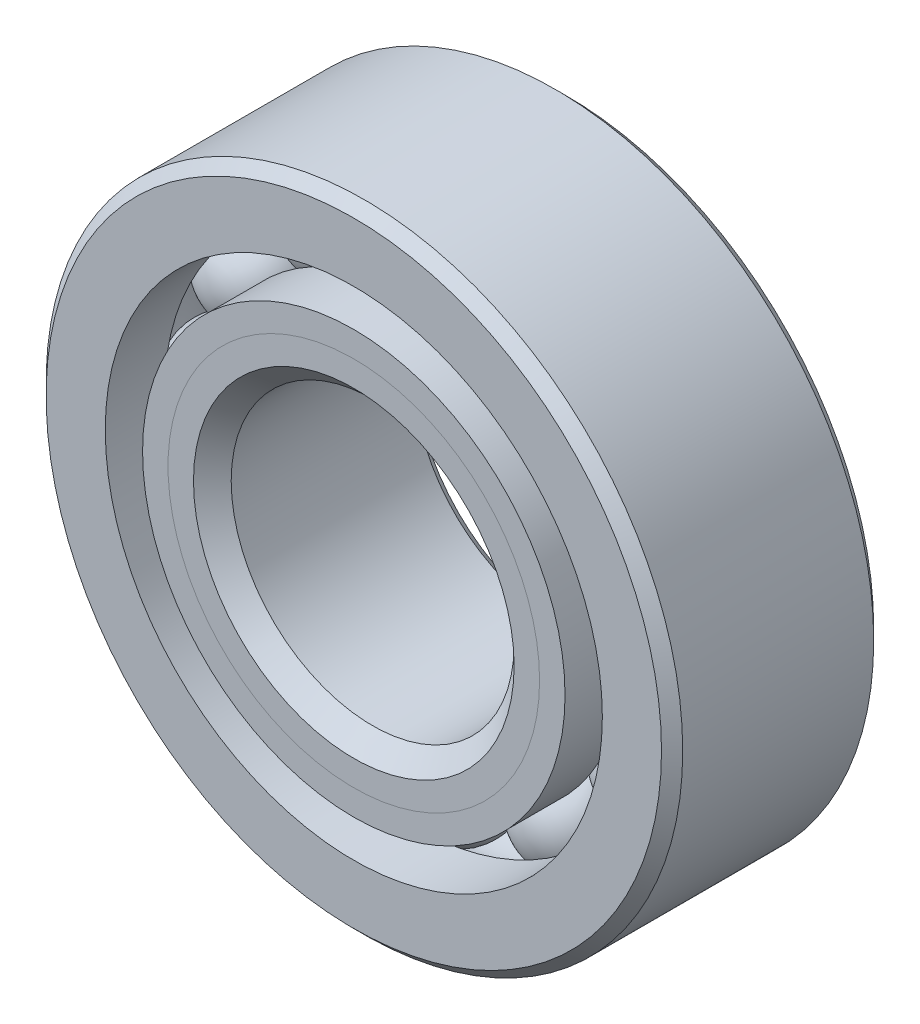
from build123d import *

# Parameters (mm, degrees)
CIRPATTERN1_COUNT = 12


with BuildPart() as part:
    # Sketch1 → Revolve1 (revolve)
    with BuildSketch(Plane(origin=(0, 0, 0), x_dir=(0, 0, -1), z_dir=(1, 0, 0))):
        with BuildLine():
            Line((4.28625, 14.2875), (-4.28625, 14.2875))
            Line((-4.28625, 14.2875), (-4.7625, 13.81125))
            Line((-4.7625, 13.81125), (-4.7625, 11.156112637))
            Line((-4.7625, 11.156112637), (-2.116666667, 11.156112637))
            ThreePointArc((-2.116666667, 11.156112637), (0, 12.595030731), (2.116666667, 11.156112637))
            Line((2.116666667, 11.156112637), (4.7625, 11.156112637))
            Line((4.7625, 11.156112637), (4.7625, 13.81125))
            Line((4.7625, 13.81125), (4.28625, 14.2875))
        make_face()
    revolve(axis=Axis((0, 0, 4.7625), (0, 0, -1)))


with BuildPart() as body_2:
    # Sketch2 → Revolve2 (revolve)
    with BuildSketch(Plane(origin=(0, 0, 0), x_dir=(0, 0, -1), z_dir=(1, 0, 0))):
        with BuildLine():
            Line((-4.7625, 9.481387363), (-2.116666667, 9.481387363))
            ThreePointArc((-2.116666667, 9.481387363), (-1.279722925, 8.436261434), (0, 8.042469269))
            Line((0, 8.042469269), (0, 7.196234635))
            Line((0, 7.196234635), (-3.619923636, 7.196234635))
            Line((-3.619923636, 7.196234635), (-4.7625, 8.338810999))
            Line((-4.7625, 8.338810999), (-4.7625, 9.481387363))
        make_face()
    revolve(axis=Axis((0, 0, 4.7625), (0, 0, -1)))


with BuildPart() as body_3:
    # Sketch3 → Revolve3 (revolve)
    with BuildSketch(Plane(origin=(0, 0, 0), x_dir=(0, 0, -1), z_dir=(1, 0, 0))):
        with BuildLine():
            Line((-4.7625, 8.338810999), (-3.619923636, 7.196234635))
            Line((-3.619923636, 7.196234635), (0, 7.196234635))
            Line((0, 7.196234635), (0, 8.042469269))
            ThreePointArc((0, 8.042469269), (1.279722925, 8.436261434), (2.116666667, 9.481387363))
            Line((2.116666667, 9.481387363), (4.7625, 9.481387363))
            Line((4.7625, 9.481387363), (4.7625, 6.82625))
            Line((4.7625, 6.82625), (4.28625, 6.35))
            Line((4.28625, 6.35), (-3.916265365, 6.35))
            Line((-3.916265365, 6.35), (-4.7625, 7.196234635))
            Line((-4.7625, 7.196234635), (-4.7625, 8.338810999))
        make_face()
    revolve(axis=Axis((0, 0, 4.7625), (0, 0, -1)))


with BuildPart() as body_4:
    # Sketch4 → Revolve4 (revolve)
    with BuildSketch(Plane(origin=(0, 0, 0), x_dir=(0, 0, -1), z_dir=(1, 0, 0))):
        with BuildLine():
            Line((-2.276280731, 10.31875), (2.276280731, 10.31875))
            ThreePointArc((2.276280731, 10.31875), (0, 12.595030731), (-2.276280731, 10.31875))
        make_face()
    revolve(axis=Axis((0, 10.31875, 2.276280731), (0, 0, -1)))


with BuildPart() as cirpattern1_1:
    # CirPattern1: pattern copy
    add(body_4.part.rotate(Axis((0, 0, -4.7625), (0, 0, 1)), 1 * 360 / CIRPATTERN1_COUNT))


with BuildPart() as cirpattern1_2:
    # CirPattern1: pattern copy
    add(body_4.part.rotate(Axis((0, 0, -4.7625), (0, 0, 1)), 2 * 360 / CIRPATTERN1_COUNT))


with BuildPart() as cirpattern1_3:
    # CirPattern1: pattern copy
    add(body_4.part.rotate(Axis((0, 0, -4.7625), (0, 0, 1)), 3 * 360 / CIRPATTERN1_COUNT))


with BuildPart() as cirpattern1_4:
    # CirPattern1: pattern copy
    add(body_4.part.rotate(Axis((0, 0, -4.7625), (0, 0, 1)), 4 * 360 / CIRPATTERN1_COUNT))


with BuildPart() as cirpattern1_5:
    # CirPattern1: pattern copy
    add(body_4.part.rotate(Axis((0, 0, -4.7625), (0, 0, 1)), 5 * 360 / CIRPATTERN1_COUNT))


with BuildPart() as cirpattern1_6:
    # CirPattern1: pattern copy
    add(body_4.part.rotate(Axis((0, 0, -4.7625), (0, 0, 1)), 6 * 360 / CIRPATTERN1_COUNT))


with BuildPart() as cirpattern1_7:
    # CirPattern1: pattern copy
    add(body_4.part.rotate(Axis((0, 0, -4.7625), (0, 0, 1)), 7 * 360 / CIRPATTERN1_COUNT))


with BuildPart() as cirpattern1_8:
    # CirPattern1: pattern copy
    add(body_4.part.rotate(Axis((0, 0, -4.7625), (0, 0, 1)), 8 * 360 / CIRPATTERN1_COUNT))


with BuildPart() as cirpattern1_9:
    # CirPattern1: pattern copy
    add(body_4.part.rotate(Axis((0, 0, -4.7625), (0, 0, 1)), 9 * 360 / CIRPATTERN1_COUNT))


with BuildPart() as cirpattern1_10:
    # CirPattern1: pattern copy
    add(body_4.part.rotate(Axis((0, 0, -4.7625), (0, 0, 1)), 10 * 360 / CIRPATTERN1_COUNT))


with BuildPart() as cirpattern1_11:
    # CirPattern1: pattern copy
    add(body_4.part.rotate(Axis((0, 0, -4.7625), (0, 0, 1)), 11 * 360 / CIRPATTERN1_COUNT))


solid = Compound([part.part, body_2.part, body_3.part, body_4.part, cirpattern1_1.part, cirpattern1_2.part, cirpattern1_3.part, cirpattern1_4.part, cirpattern1_5.part, cirpattern1_6.part, cirpattern1_7.part, cirpattern1_8.part, cirpattern1_9.part, cirpattern1_10.part, cirpattern1_11.part])
